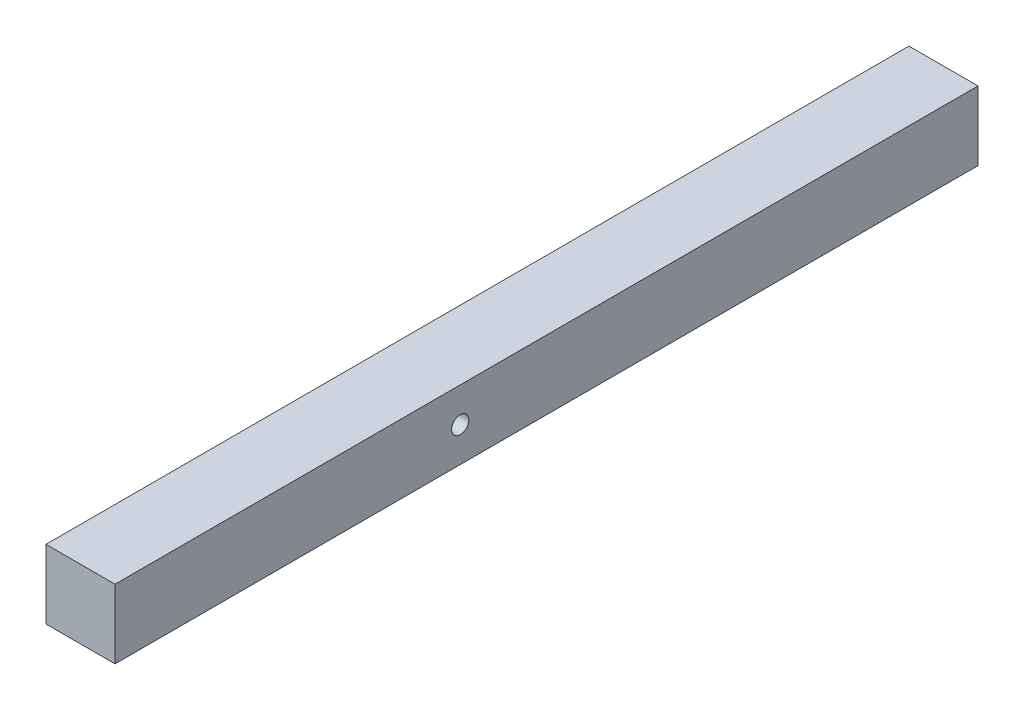
from build123d import *

# Parameters (mm, degrees)
SKETCH2_W               = 100
SKETCH2_H               = 100
BOSS_EXTRUDE1_DEPTH     = 1250
CUT_EXTRUDE2_DEPTH      = 1255.990039801
CUT_EXTRUDE2_DEPTH_BACK = 1255.990039801
SKETCH4_R               = 12.5


with BuildPart() as part:
    # Sketch2 → Boss-Extrude1 (new body)
    with BuildSketch(Plane.XY):
        Rectangle(SKETCH2_W, SKETCH2_H)
    extrude(amount=-BOSS_EXTRUDE1_DEPTH)

    # Sketch4 → Cut-Extrude2 (cut, two sides: drawn at the far end of the back side and taken through both)
    with BuildSketch(Plane(origin=(50, 0, 0), x_dir=(0, 0, -1), z_dir=(1, 0, 0)).offset(-CUT_EXTRUDE2_DEPTH_BACK)):
        with Locations((500, 0)):
            Circle(SKETCH4_R)
    extrude(amount=CUT_EXTRUDE2_DEPTH + CUT_EXTRUDE2_DEPTH_BACK, mode=Mode.SUBTRACT)


solid = part.part
